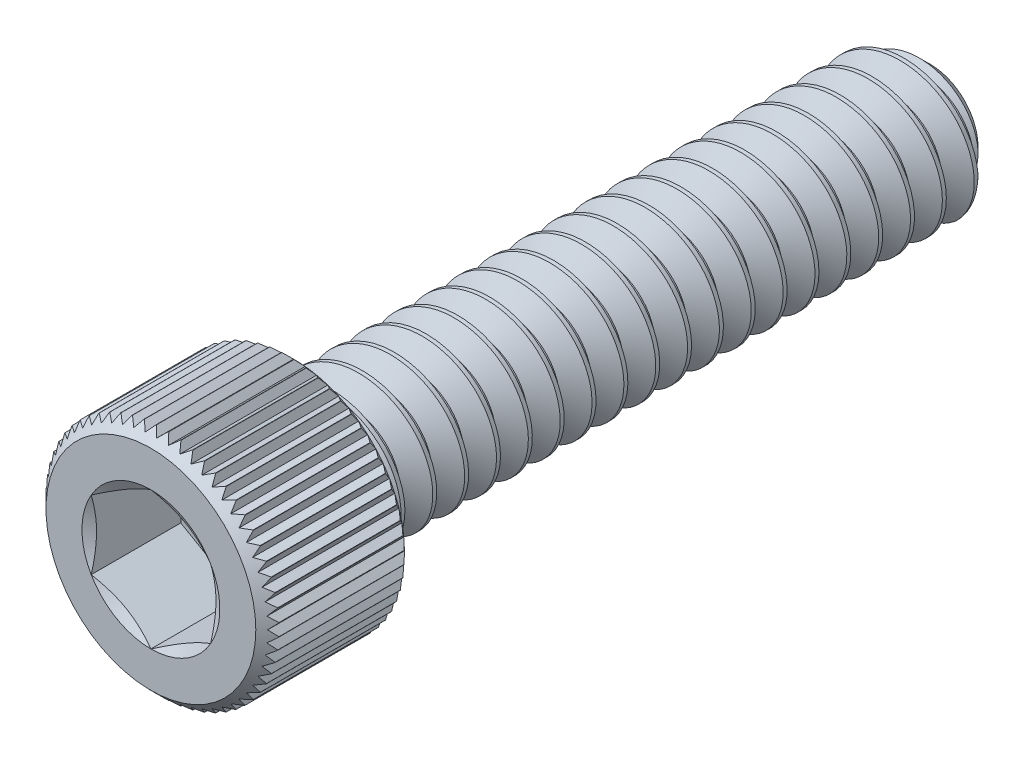
from build123d import *
from build123d.topology import SkipClean

# Parameters (mm, degrees)
CUT_EXTRUDE1_DEPTH = 1.7859375
CHAMFER1_SIZE      = 0.23241
CHAMFER2_SIZE      = 0.116205
CUT_SWEEP1_PITCH   = 0.635
CUT_SWEEP1_TO      = 12.7
CUT_EXTRUDE3_REACH = 15.118
CIRPATTERN1_COUNT  = 60


with BuildPart() as part:
    # Sketch2 → Revolve1 (revolve)
    with BuildSketch(Plane(origin=(0, 0, 0), x_dir=(0, 0, -1), z_dir=(1, 0, 0)), mode=Mode.PRIVATE) as revolve1_sk:
        Polygon((7.7724, 0.94615), (7.29615, 1.4224), (-4.9276, 1.4224), (-4.9276, 2.3241), (-7.7724, 2.3241), (-7.7724, 0), (7.7724, 0), align=None)
    revolve(revolve1_sk.sketch.rotate(Axis((0, 0, -7.7724), (0, 0, 1)), 90), axis=Axis((0, 0, -7.7724), (0, 0, 1)))

    # Sketch4 → Cut-Extrude1 (cut)
    with BuildSketch(Plane.XY.offset(7.7724)):
        Polygon((0, 1.374815329), (-1.190625, 0.687407664), (-1.190625, -0.687407664), (0, -1.374815329), (1.190625, -0.687407664), (1.190625, 0.687407664), align=None)
    extrude(amount=-CUT_EXTRUDE1_DEPTH, mode=Mode.SUBTRACT)

    # Cut-Extrude2 cone 1 section (through the dimple's axis) → Cut-Extrude2 (revolve, cut)
    with BuildSketch(Plane(origin=(0, 0, 7.7724), x_dir=(0, -1, 0), z_dir=(1, 0, 0))):
        Polygon((0, 0), (1.374815329, 0), (0, 0.79375), align=None)
    revolve(axis=Axis((0, 0, 7.7724), (0, 0, -1)), mode=Mode.SUBTRACT)

    # Chamfer1
    chamfer1_edges = [part.edges().sort_by_distance(p)[0] for p in [
        (2.3241, 0, 7.7724),
    ]]
    chamfer(chamfer1_edges, length=CHAMFER1_SIZE)

    # Chamfer2
    chamfer2_edges = [part.edges().sort_by_distance(p)[0] for p in [
        (2.3241, 0, 4.9276),
    ]]
    chamfer(chamfer2_edges, length=CHAMFER2_SIZE)


with BuildPart() as body_2:
    # Split1: read off the stored shape, not the designer's step
    # Split1: the piece on the far side of the plane
    add(part.part)
    split(bisect_by=Plane.XY.offset(4.9276), keep=Keep.BOTTOM)

    # Cut-Sweep1: arcs per turn and ends read off the stored shape
    # Cut-Sweep1: the profile of Sketch7 profile screwed along a right-hand helix through 21 turns, 6 arcs to a turn; built about Z, then put on its axis
    cut_sweep1_z = Axis((0, 0, 0), (0, 0, 1))
    cut_sweep1_corners = [(1.4227, 0, 0.000173205), (1.4227, 0, -0.555798205), (1.009955401, 0, -0.3175), (1.009955401, 0, -0.238125)]
    with BuildLine(mode=Mode.PRIVATE) as cut_sweep1_profile:
        Line(cut_sweep1_corners[0], cut_sweep1_corners[1])
        Line(cut_sweep1_corners[1], cut_sweep1_corners[2])
        Line(cut_sweep1_corners[2], cut_sweep1_corners[3])
        Line(cut_sweep1_corners[3], cut_sweep1_corners[0])
    cut_sweep1_cap = Face(cut_sweep1_profile.wire())
    cut_sweep1_turn_angles = [0, 30, 60, 90, 120, 150, 180, 210, 240, 270, 300, 330, 360]
    cut_sweep1_turn_weights = [1, 0.8660254037844387, 1, 0.8660254037844387, 1, 0.8660254037844387, 1, 0.8660254037844387, 1, 0.8660254037844387, 1, 0.8660254037844387, 1]
    cut_sweep1_turn_rails = [Edge.make_bspline([Vector(p[0], p[1], 0).rotate(cut_sweep1_z, cut_sweep1_turn_angles[k]) / cut_sweep1_turn_weights[k] + Vector(0, 0, p[2] + CUT_SWEEP1_PITCH * cut_sweep1_turn_angles[k] / 360) for k in range(13)], [0, 0, 0, 1, 1, 2, 2, 3, 3, 4, 4, 5, 5, 6, 6, 6], 2, cut_sweep1_turn_weights) for p in cut_sweep1_corners]
    cut_sweep1_turn_sides = [Face.make_surface_from_curves(cut_sweep1_turn_rails[p[0]], cut_sweep1_turn_rails[p[1]]) for p in [(0, 1), (1, 2), (2, 3), (3, 0)]]
    cut_sweep1 = Plane(origin=(0, 0, -7.7724), x_dir=(0, 1, 0), z_dir=(0, 0, 1)) * split(Solid(Shell([*[p.moved(Location((0, 0, CUT_SWEEP1_PITCH * i))) for i in range(21) for p in cut_sweep1_turn_sides], cut_sweep1_cap, cut_sweep1_cap.rotate(cut_sweep1_z, 7560).moved(Location((0, 0, CUT_SWEEP1_PITCH * 7560 / 360)))])), bisect_by=Plane.XY.offset(CUT_SWEEP1_TO), keep=Keep.BOTTOM, mode=Mode.PRIVATE)
    add(cut_sweep1, mode=Mode.SUBTRACT)


with BuildPart() as part_1:
    add(part.part)

    # Split1
    split(bisect_by=Plane.XY.offset(4.9276), keep=Keep.TOP)

    add(body_2.part)  # Boss-Extrude4 merges body 2
    # Boss-Extrude4: read off the stored shape, not the designer's step
    # Boss-Extrude4 outline → Boss-Extrude4 (revolve)
    with BuildSketch(Plane.XZ):
        Polygon((1.009908701, 4.9276), (1.009908701, 4.446367934), (1.491140766, 4.9276), align=None)
    revolve(axis=Axis((0, 0, 0), (0, 0, 1)))

    # Cut-Extrude3: up to this cone (the profile starts inside it)
    with SkipClean():  # the faces are left unmerged after this step: merging them gives an invalid solid
        cut_extrude3_end = Plane(origin=(0, 0, 4.9276), z_dir=(0, 0, -1)).offset(-4.936489) * Cone(1e-06, 25.49098, 25.490979, align=(Align.CENTER, Align.CENTER, Align.MIN), mode=Mode.PRIVATE)
        # Sketch9 → Cut-Extrude3 (cut, up to the surface)
        with BuildSketch(Plane(origin=(0, 0, 4.9276), x_dir=(-1, 0, 0), z_dir=(0, 0, -1)), mode=Mode.PRIVATE) as cut_extrude3_sk1:
            Polygon((0, 2.207895), (-0.24360184, 2.440305), (0.24360184, 2.440305), align=None)
        cut_extrude3_tool1 = extrude(cut_extrude3_sk1.sketch, amount=-CUT_EXTRUDE3_REACH, mode=Mode.PRIVATE) & cut_extrude3_end
        cut_extrude3 = cut_extrude3_tool1.solids().sort_by_distance((0, 2.362835, 4.9276))[0]
        add(cut_extrude3, mode=Mode.SUBTRACT)

    # CirPattern1: Cut-Extrude3 ×60 about axis
    cirpattern1_axis = Axis((0, 0, 0), (0, 0, 1))
    for i in range(1, CIRPATTERN1_COUNT):
        add(cut_extrude3.rotate(cirpattern1_axis, i * 360 / CIRPATTERN1_COUNT), mode=Mode.SUBTRACT)


solid = part_1.part
